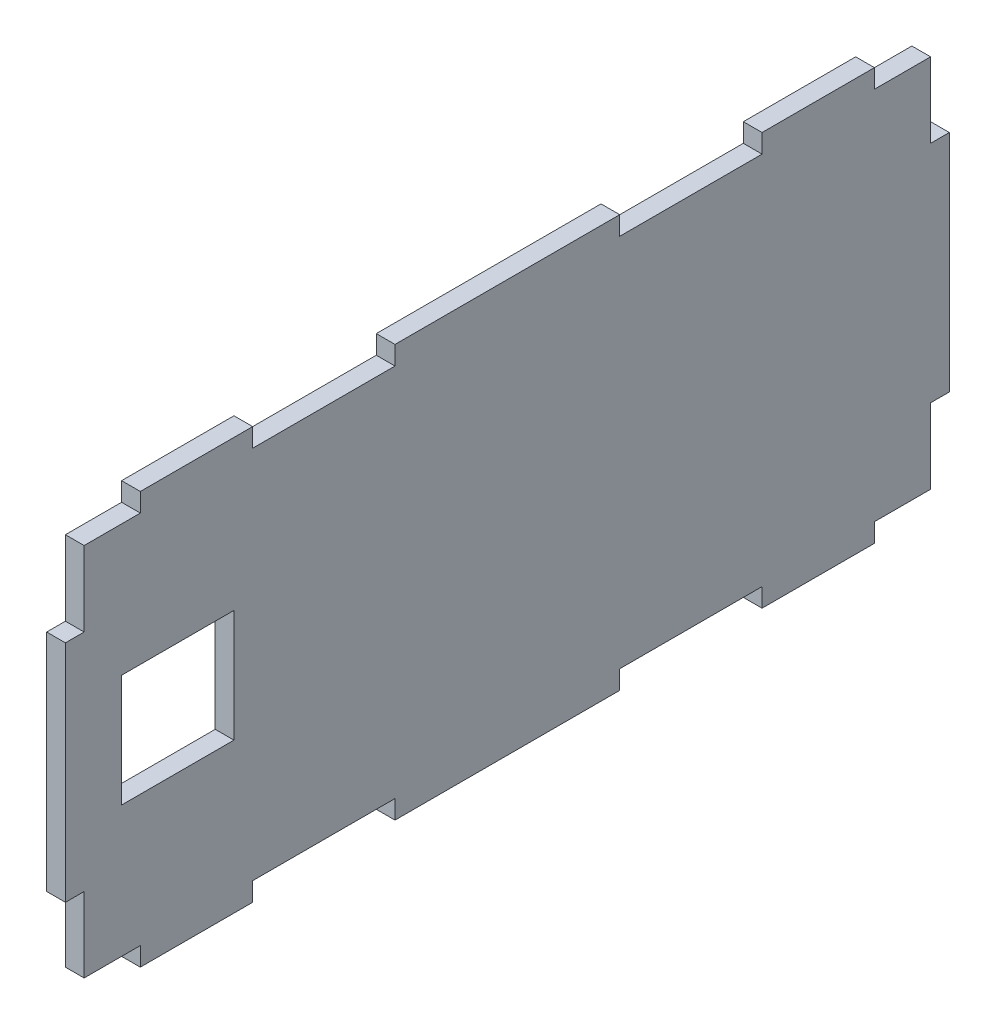
from build123d import *

# Parameters (mm, degrees)
SKETCH1_W           = 30
SKETCH1_H           = 30
BOSS_EXTRUDE1_DEPTH = 5


with BuildPart() as part:
    # Sketch1 → Boss-Extrude1 (new body)
    with BuildSketch(Plane(origin=(0, 0, 0), x_dir=(0, 0, -1), z_dir=(1, 0, 0))):
        Polygon((98, -50), (113, -50), (113, -30), (118, -30), (118, 30), (113, 30), (113, 50), (98, 50), (98, 55), (68, 55), (68, 50), (30, 50), (30, 55), (-30, 55), (-30, 50), (-68, 50), (-68, 55), (-98, 55), (-98, 50), (-113, 50), (-113, 30), (-118, 30), (-118, -30), (-113, -30), (-113, -50), (-98, -50), (-98, -55), (-68, -55), (-68, -50), (-30, -50), (-30, -55), (30, -55), (30, -50), (68, -50), (68, -55), (98, -55), align=None)
        with Locations((-88, 0)):
            Rectangle(SKETCH1_W, SKETCH1_H, mode=Mode.SUBTRACT)
    extrude(amount=BOSS_EXTRUDE1_DEPTH)


solid = part.part
